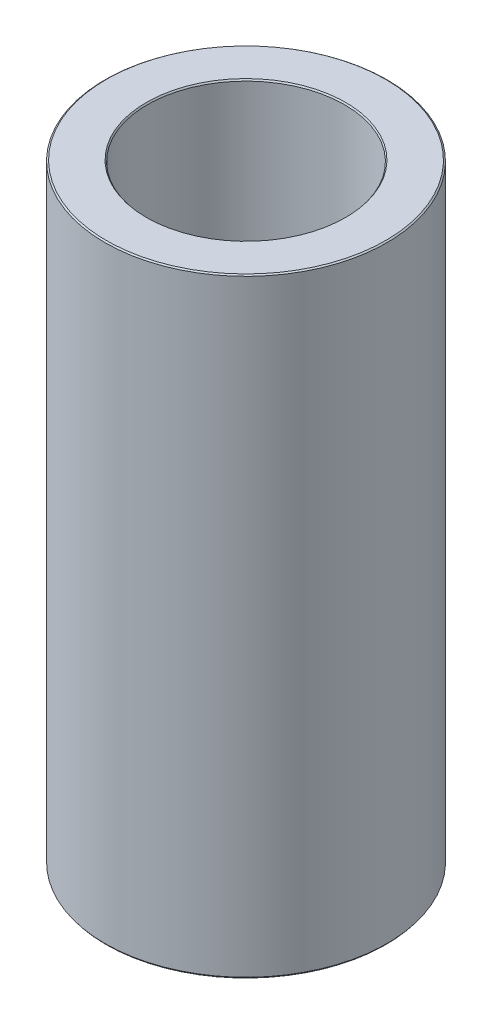
from build123d import *
from OCP.BRepFilletAPI import BRepFilletAPI_MakeChamfer

# Parameters (mm, degrees)
SKETCH1_R           = 42.5
BOSS_EXTRUDE1_DEPTH = 183.632850368
SKETCH2_R           = 29.709421918
CUT_EXTRUDE1_DEPTH  = 194.218849325
CHAMFER1_SIZE       = 0.3217282
CHAMFER1_SIZE2      = 0.430853037


with BuildPart() as part:
    # Sketch1 → Boss-Extrude1 (new body)
    with BuildSketch(Plane(origin=(0, 0, 0), x_dir=(1, 0, 0), z_dir=(0, 1, 0))):
        Circle(SKETCH1_R)
    extrude(amount=BOSS_EXTRUDE1_DEPTH)

    # Sketch2 → Cut-Extrude1 (cut, through all)
    with BuildSketch(Plane(origin=(0, 0, 0), x_dir=(1, 0, 0), z_dir=(0, 1, 0))):
        Circle(SKETCH2_R)
    extrude(amount=CUT_EXTRUDE1_DEPTH, mode=Mode.SUBTRACT)

    # Chamfer1: one chamfer whose edges measure the first distance from different faces: ONE call of the kernel's chamfer builder (chamfer() names one face for all edges)
    chamfer1_edges_1 = [part.edges().sort_by_distance(p)[0] for p in [
        (-29.709421918, 183.632850368, 0),
    ]]
    chamfer1_side_1 = [part.faces().sort_by_distance(p)[0] for p in [
        (-41.297918472, 183.632850368, 0),
    ]]
    chamfer1_edges_2 = [part.edges().sort_by_distance(p)[0] for p in [
        (-29.709421918, 0, 0),
    ]]
    chamfer1_side_2 = [part.faces().sort_by_distance(p)[0] for p in [
        (-29.709421918, 91.816425184, 0),
    ]]
    chamfer1_edges_3 = [part.edges().sort_by_distance(p)[0] for p in [
        (-42.5, 0, 0),
    ]]
    chamfer1_side_3 = [part.faces().sort_by_distance(p)[0] for p in [
        (-41.297918472, 0, 0),
    ]]
    chamfer1_edges_4 = [part.edges().sort_by_distance(p)[0] for p in [
        (-42.5, 183.632850368, 0),
    ]]
    chamfer1_side_4 = [part.faces().sort_by_distance(p)[0] for p in [
        (-42.5, 91.816425184, 0),
    ]]
    chamfer1 = BRepFilletAPI_MakeChamfer(part.part.solid().wrapped)
    for e in chamfer1_edges_1:
        chamfer1.Add(CHAMFER1_SIZE, CHAMFER1_SIZE2, e.wrapped, chamfer1_side_1[0].wrapped)  # the first distance lies on this face
    for e in chamfer1_edges_2:
        chamfer1.Add(CHAMFER1_SIZE, CHAMFER1_SIZE2, e.wrapped, chamfer1_side_2[0].wrapped)  # the first distance lies on this face
    for e in chamfer1_edges_3:
        chamfer1.Add(CHAMFER1_SIZE, CHAMFER1_SIZE2, e.wrapped, chamfer1_side_3[0].wrapped)  # the first distance lies on this face
    for e in chamfer1_edges_4:
        chamfer1.Add(CHAMFER1_SIZE, CHAMFER1_SIZE2, e.wrapped, chamfer1_side_4[0].wrapped)  # the first distance lies on this face
    add(Compound.cast(chamfer1.Shape()), mode=Mode.REPLACE)


solid = part.part
